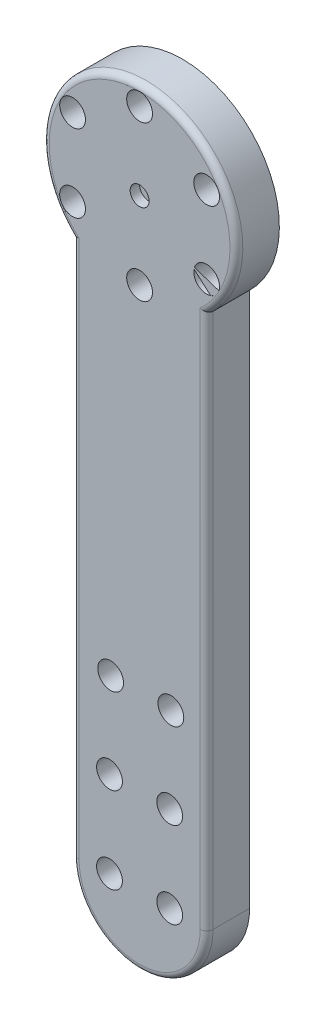
from build123d import *

# Parameters (mm, degrees)
SKETCH_1_R          = 22.5
SKETCH_1_R_2        = 1.7
EXTRUDE_1_DEPTH     = 10
EXTRUDE_2_DEPTH     = 10
FILLET_1_R          = 1.5
SKETCH_3_R          = 1.6
CUT_EXTRUDE_1_DEPTH = 159.216092453
SKETCH_5_R          = 2.2
CUT_EXTRUDE_2_DEPTH = 2.2
SKETCH_6_R          = 3
CUT_EXTRUDE_3_DEPTH = 5


# Read off the part's stored shape, not the designer's step: 凸台-拉伸2
with BuildPart() as part:
    # 草图1 → 凸台-拉伸1 (new body)
    with BuildSketch(Plane.XY):
        Circle(SKETCH_1_R)
        with Locations((-15.588457268, 9)):
            Circle(SKETCH_1_R_2, mode=Mode.SUBTRACT)
        with Locations((0, 18)):
            Circle(SKETCH_1_R_2, mode=Mode.SUBTRACT)
        with Locations((15.588457268, 9)):
            Circle(SKETCH_1_R_2, mode=Mode.SUBTRACT)
        with Locations((15.588457268, -9)):
            Circle(SKETCH_1_R_2, mode=Mode.SUBTRACT)
        with Locations((0, -18)):
            Circle(SKETCH_1_R_2, mode=Mode.SUBTRACT)
        with Locations((-15.588457268, -9)):
            Circle(SKETCH_1_R_2, mode=Mode.SUBTRACT)
    extrude(amount=EXTRUDE_1_DEPTH)

    # 凸台-拉伸2 outline → 凸台-拉伸2 (add)
    with BuildSketch(Plane.XY):
        with BuildLine():
            Line((15.588457268, -140.7), (15.588457268, -16.22498074))
            ThreePointArc((15.588457268, -16.22498074), (0, -22.5), (-15.588457268, -16.22498074))
            Line((-15.588457268, -16.22498074), (-15.588457268, -140.7))
            ThreePointArc((-15.588457268, -140.7), (0, -156.288457268), (15.588457268, -140.7))
        make_face()
    extrude(amount=EXTRUDE_2_DEPTH)

    # 圆角1
    fillet_1_edges = [part.edges().sort_by_distance(p)[0] for p in [
        (0, 22.5, 10),
        (15.588457268, -78.46249037, 10),
        (-15.588457268, -78.46249037, 10),
        (0, -156.288457268, 10),
    ]]
    fillet(fillet_1_edges, radius=FILLET_1_R)

    # 草图3 → 切除-拉伸1 (cut, through all)
    with BuildSketch(Plane.XY.offset(10)):
        with Locations((7.266515313, -100.001775839)):
            Circle(SKETCH_3_R)
        with Locations((-6.733484478, -100)):
            Circle(SKETCH_3_R)
        with Locations((7, -120)):
            Circle(SKETCH_3_R)
        with Locations((7, -140)):
            Circle(SKETCH_3_R)
        with Locations((-7, -140)):
            Circle(SKETCH_3_R)
        with Locations((-7, -120)):
            Circle(SKETCH_3_R)
    extrude(amount=-CUT_EXTRUDE_1_DEPTH, mode=Mode.SUBTRACT)

    # 草图5 → 切除-拉伸2 (cut)
    with BuildSketch(Plane.XY.offset(10)):
        Circle(SKETCH_5_R)
    extrude(amount=-CUT_EXTRUDE_2_DEPTH, mode=Mode.SUBTRACT)

    # 草图6 → 切除-拉伸3 (cut)
    with BuildSketch(Plane.XY.offset(10)):
        with Locations((-15.588457268, -9)):
            Circle(SKETCH_6_R)
        with Locations((0, -18)):
            Circle(SKETCH_6_R)
        with Locations((15.588457268, -9)):
            Circle(SKETCH_6_R)
        with Locations((15.588457268, 9)):
            Circle(SKETCH_6_R)
        with Locations((0, 18)):
            Circle(SKETCH_6_R)
        with Locations((-15.588457268, 9)):
            Circle(SKETCH_6_R)
        with Locations((-6.733484478, -100)):
            Circle(SKETCH_6_R)
        with Locations((7.266515313, -100.001775839)):
            Circle(SKETCH_6_R)
        with Locations((7, -120)):
            Circle(SKETCH_6_R)
        with Locations((-7, -120)):
            Circle(SKETCH_6_R)
        with Locations((-7, -140)):
            Circle(SKETCH_6_R)
        with Locations((7, -140)):
            Circle(SKETCH_6_R)
    extrude(amount=-CUT_EXTRUDE_3_DEPTH, mode=Mode.SUBTRACT)


solid = part.part
